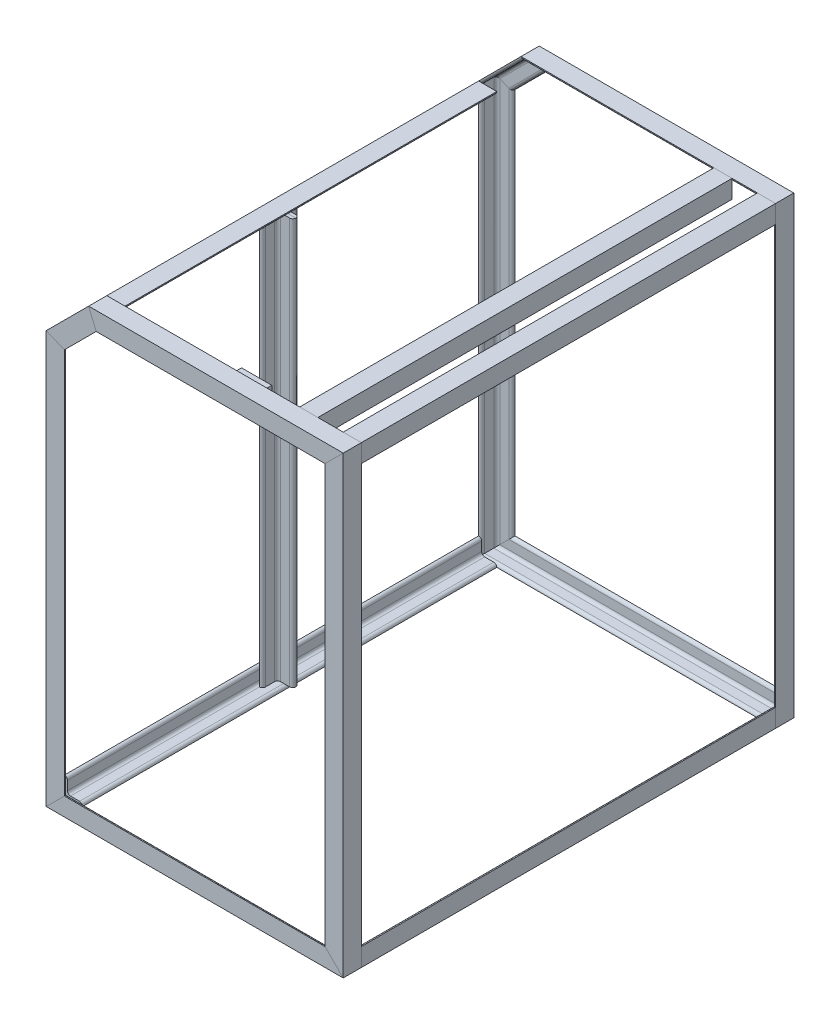
from build123d import *

# Parameters (mm, degrees)
ANGLE_IRON_CONFIGURED_35_X_35_X_5_1_DEPTH      = 793.426406871
ANGLE_IRON_CONFIGURED_35_X_35_X_5_1_DEPTH_BACK = 43.426406871
ANGLE_IRON_CONFIGURED_35_X_35_X_5_1_2_DEPTH    = 576.852813742
ANGLE_IRON_CONFIGURED_35_X_35_X_5_1_3_DEPTH    = 742
ANGLE_IRON_CONFIGURED_35_X_35_X_5_1_4_DEPTH    = 136.142135624
ANGLE_IRON_CONFIGURED_35_X_35_X_5_1_5_DEPTH    = 482
ANGLE_START                                    = -713.4
ANGLE_IRON_CONFIGURED_35_X_35_X_5_11_DEPTH     = 683.4
ANGLE_IRON_CONFIGURED_35_X_35_X_5_13_DEPTH     = 670
ANGLE_IRON_CONFIGURED_35_X_35_X_5_14_DEPTH     = 670
ANGLE_IRON_CONFIGURED_35_X_35_X_5_15_DEPTH     = 50
SKETCH19_R                                     = 4.5
CUT_EXTRUDE1_DEPTH                             = 10
ANGLE_IRON_CONFIGURED_35_X_35_X_5_16_DEPTH     = 683.4


# Read off the part's stored shape, not the designer's step: Angle iron - configured 35 X 35 X 5(2)
with BuildPart() as part:
    # Sketch11 → Angle iron - configured 35 X 35 X 5(1) (new, two sides: drawn at the far end of the back side and taken through both)
    with BuildSketch(Plane(origin=(245, 375, 0), x_dir=(-1, 0, 0), z_dir=(0, -1, 0)).offset(-ANGLE_IRON_CONFIGURED_35_X_35_X_5_1_DEPTH_BACK)):
        with BuildLine():
            Line((0, 0), (0, 30))
            ThreePointArc((0, 30), (3.535533906, 28.535533906), (5, 25))
            Line((5, 25), (5, 10))
            ThreePointArc((5, 10), (6.464466094, 6.464466094), (10, 5))
            Line((10, 5), (25, 5))
            ThreePointArc((25, 5), (28.535533906, 3.535533906), (30, 0))
            Line((30, 0), (0, 0))
        make_face()
    extrude(amount=ANGLE_IRON_CONFIGURED_35_X_35_X_5_1_DEPTH + ANGLE_IRON_CONFIGURED_35_X_35_X_5_1_DEPTH_BACK)

    # Angle iron - configured 35 X 35 X 5(1) mi
    split(bisect_by=Plane(origin=(245, -375, 0), x_dir=(-0.707106781, 0.707106781, 0), z_dir=(0.707106781, 0.707106781, 0)), keep=Keep.TOP)

    # Angle iron - configured 35 X 35 X 5_ 2
    split(bisect_by=Plane(origin=(245, 375, 0), x_dir=(0.707106781, 0.707106781, 0), z_dir=(0.707106781, -0.707106781, 0)), keep=Keep.TOP)


with BuildPart() as body_2:
    # Sketch11 on segment 2 (carried to segment 2) → Angle iron - configured 35 X 35 X 5_1 2 (new body)
    with BuildSketch(Plane(origin=(288.426406871, -375, 0), x_dir=(0, 1, 0), z_dir=(-1, 0, 0))):
        with BuildLine():
            Line((0, 0), (0, 30))
            ThreePointArc((0, 30), (3.535533906, 28.535533906), (5, 25))
            Line((5, 25), (5, 10))
            ThreePointArc((5, 10), (6.464466094, 6.464466094), (10, 5))
            Line((10, 5), (25, 5))
            ThreePointArc((25, 5), (28.535533906, 3.535533906), (30, 0))
            Line((30, 0), (0, 0))
        make_face()
    extrude(amount=ANGLE_IRON_CONFIGURED_35_X_35_X_5_1_2_DEPTH)

    # Angle iron - configured 35 X 35 X 5_ 3
    split(bisect_by=Plane(origin=(-245, -375, 0), x_dir=(0.707106781, 0.707106781, 0), z_dir=(0.707106781, -0.707106781, 0)), keep=Keep.TOP)

    # Angle iron - configured 35 X 35 X 5_ 4
    split(bisect_by=Plane(origin=(245, -375, 0), x_dir=(0.707106781, -0.707106781, 0), z_dir=(-0.707106781, -0.707106781, 0)), keep=Keep.TOP)


with BuildPart() as body_3:
    # Sketch11 on segment 3 (carried to segment 3) → Angle iron - configured 35 X 35 X 5_1 3 (new body)
    with BuildSketch(Plane(origin=(-245, -418.426406871, 0), x_dir=(1, 0, 0), z_dir=(0, 1, 0))):
        with BuildLine():
            Line((0, 0), (0, 30))
            ThreePointArc((0, 30), (3.535533906, 28.535533906), (5, 25))
            Line((5, 25), (5, 10))
            ThreePointArc((5, 10), (6.464466094, 6.464466094), (10, 5))
            Line((10, 5), (25, 5))
            ThreePointArc((25, 5), (28.535533906, 3.535533906), (30, 0))
            Line((30, 0), (0, 0))
        make_face()
    extrude(amount=ANGLE_IRON_CONFIGURED_35_X_35_X_5_1_3_DEPTH)

    # Angle iron - configured 35 X 35 X 5_ 5
    split(bisect_by=Plane(origin=(-245, -375, 0), x_dir=(-0.707106781, -0.707106781, 0), z_dir=(-0.707106781, 0.707106781, 0)), keep=Keep.TOP)

    # Angle iron - configured 35 X 35 X 5_ 6
    split(bisect_by=Plane(origin=(-245, 305, 0), x_dir=(0.923879533, -0.382683432, 0), z_dir=(-0.382683432, -0.923879533, 0)), keep=Keep.TOP)


with BuildPart() as body_4:
    # Sketch11 on segment 4 (carried to segment 4) → Angle iron - configured 35 X 35 X 5_1 4 (new body)
    with BuildSketch(Plane(origin=(-258.133513652, 291.866486348, 0), x_dir=(0.707106781, -0.707106781, 0), z_dir=(0.707106781, 0.707106781, 0))):
        with BuildLine():
            Line((0, 0), (0, 30))
            ThreePointArc((0, 30), (3.535533906, 28.535533906), (5, 25))
            Line((5, 25), (5, 10))
            ThreePointArc((5, 10), (6.464466094, 6.464466094), (10, 5))
            Line((10, 5), (25, 5))
            ThreePointArc((25, 5), (28.535533906, 3.535533906), (30, 0))
            Line((30, 0), (0, 0))
        make_face()
    extrude(amount=ANGLE_IRON_CONFIGURED_35_X_35_X_5_1_4_DEPTH)

    # Angle iron - configured 35 X 35 X 5_ 7
    split(bisect_by=Plane(origin=(-245, 305, 0), x_dir=(-0.923879533, 0.382683432, 0), z_dir=(0.382683432, 0.923879533, 0)), keep=Keep.TOP)

    # Angle iron - configured 35 X 35 X 5_ 8
    split(bisect_by=Plane(origin=(-175, 375, 0), x_dir=(0.382683432, -0.923879533, 0), z_dir=(-0.923879533, -0.382683432, 0)), keep=Keep.TOP)


with BuildPart() as body_5:
    # Sketch11 on segment 5 (carried to segment 5) → Angle iron - configured 35 X 35 X 5_1 5 (new body)
    with BuildSketch(Plane(origin=(-193.573593129, 375, 0), x_dir=(0, -1, 0), z_dir=(1, 0, 0))):
        with BuildLine():
            Line((0, 0), (0, 30))
            ThreePointArc((0, 30), (3.535533906, 28.535533906), (5, 25))
            Line((5, 25), (5, 10))
            ThreePointArc((5, 10), (6.464466094, 6.464466094), (10, 5))
            Line((10, 5), (25, 5))
            ThreePointArc((25, 5), (28.535533906, 3.535533906), (30, 0))
            Line((30, 0), (0, 0))
        make_face()
    extrude(amount=ANGLE_IRON_CONFIGURED_35_X_35_X_5_1_5_DEPTH)

    # Angle iron - configured 35 X 35 X 5_ 9
    split(bisect_by=Plane(origin=(-175, 375, 0), x_dir=(-0.382683432, 0.923879533, 0), z_dir=(0.923879533, 0.382683432, 0)), keep=Keep.TOP)

    # Angle iron - configured 35 X 35 X 5_ 10
    split(bisect_by=Plane(origin=(245, 375, 0), x_dir=(-0.707106781, -0.707106781, 0), z_dir=(-0.707106781, 0.707106781, 0)), keep=Keep.TOP)


with BuildPart() as body_6:
    # Mirror1: mirrored copy
    add(body_4.part.mirror(Plane.XY.offset(-371.7)))


with BuildPart() as body_7:
    # Mirror1 2: mirrored copy
    add(part.part.mirror(Plane.XY.offset(-371.7)))


with BuildPart() as body_8:
    # Mirror1 3: mirrored copy
    add(body_2.part.mirror(Plane.XY.offset(-371.7)))


with BuildPart() as body_9:
    # Mirror1 4: mirrored copy
    add(body_3.part.mirror(Plane.XY.offset(-371.7)))


with BuildPart() as body_10:
    # Mirror1 5: mirrored copy
    add(body_5.part.mirror(Plane.XY.offset(-371.7)))


with BuildPart() as body_11:
    # Angle iron - configured 35 X 35 X 5_ 12 → Angle iron - configured 35 X 35 X 5_ 11 (new body)
    with BuildSketch(Plane.XY.offset(ANGLE_START)):
        with BuildLine():
            Line((-245, 305), (-245, 275))
            ThreePointArc((-245, 275), (-241.464466094, 276.464466094), (-240, 280))
            Line((-240, 280), (-240, 295))
            ThreePointArc((-240, 295), (-238.535533906, 298.535533906), (-235, 300))
            Line((-235, 300), (-220, 300))
            ThreePointArc((-220, 300), (-216.464466094, 301.464466094), (-215, 305))
            Line((-215, 305), (-245, 305))
        make_face()
        with BuildLine():
            Line((-245, -345), (-245, -375))
            Line((-245, -375), (-215, -375))
            ThreePointArc((-215, -375), (-216.464466094, -371.464466094), (-220, -370))
            Line((-220, -370), (-235, -370))
            ThreePointArc((-235, -370), (-238.535533906, -368.535533906), (-240, -365))
            Line((-240, -365), (-240, -350))
            ThreePointArc((-240, -350), (-241.464466094, -346.464466094), (-245, -345))
        make_face()
        with BuildLine():
            Line((235, -370), (220, -370))
            ThreePointArc((220, -370), (216.464466094, -371.464466094), (215, -375))
            Line((215, -375), (245, -375))
            Line((245, -375), (245, -345))
            ThreePointArc((245, -345), (241.464466094, -346.464466094), (240, -350))
            Line((240, -350), (240, -365))
            ThreePointArc((240, -365), (238.535533906, -368.535533906), (235, -370))
        make_face()
        with BuildLine():
            Line((245, 345), (245, 375))
            Line((245, 375), (215, 375))
            ThreePointArc((215, 375), (216.464466094, 371.464466094), (220, 370))
            Line((220, 370), (235, 370))
            ThreePointArc((235, 370), (238.535533906, 368.535533906), (240, 365))
            Line((240, 365), (240, 350))
            ThreePointArc((240, 350), (241.464466094, 346.464466094), (245, 345))
        make_face()
    extrude(amount=ANGLE_IRON_CONFIGURED_35_X_35_X_5_11_DEPTH)


with BuildPart() as body_12:
    # Sketch16 → Angle iron - configured 35 X 35 X 5(13) (new body)
    with BuildSketch(Plane(origin=(-235, -370, -371.7), x_dir=(1, 0, 0), z_dir=(0, 1, 0))):
        with BuildLine():
            Line((0, 0), (0, 30))
            ThreePointArc((0, 30), (3.535533906, 28.535533906), (5, 25))
            Line((5, 25), (5, 10))
            ThreePointArc((5, 10), (6.464466094, 6.464466094), (10, 5))
            Line((10, 5), (25, 5))
            ThreePointArc((25, 5), (28.535533906, 3.535533906), (30, 0))
            Line((30, 0), (0, 0))
        make_face()
    extrude(amount=ANGLE_IRON_CONFIGURED_35_X_35_X_5_13_DEPTH)


with BuildPart() as body_13:
    # Sketch17 → Angle iron - configured 35 X 35 X 5(14) (new body)
    with BuildSketch(Plane(origin=(-235, -370, -371.7), x_dir=(1, 0, 0), z_dir=(0, -1, 0))):
        with BuildLine():
            Line((0, 0), (0, 30))
            ThreePointArc((0, 30), (3.535533906, 28.535533906), (5, 25))
            Line((5, 25), (5, 10))
            ThreePointArc((5, 10), (6.464466094, 6.464466094), (10, 5))
            Line((10, 5), (25, 5))
            ThreePointArc((25, 5), (28.535533906, 3.535533906), (30, 0))
            Line((30, 0), (0, 0))
        make_face()
    extrude(amount=-ANGLE_IRON_CONFIGURED_35_X_35_X_5_14_DEPTH)


with BuildPart() as body_14:
    # Sketch18 → Angle iron - configured 35 X 35 X 5(15) (new body)
    with BuildSketch(Plane(origin=(34.278699133, 370, -43), x_dir=(0, -1, 0), z_dir=(-1, 0, 0))):
        with BuildLine():
            Line((0, 0), (0, 35))
            ThreePointArc((0, 35), (3.535533906, 33.535533906), (5, 30))
            Line((5, 30), (5, 10))
            ThreePointArc((5, 10), (6.464466094, 6.464466094), (10, 5))
            Line((10, 5), (30, 5))
            ThreePointArc((30, 5), (33.535533906, 3.535533906), (35, 0))
            Line((35, 0), (0, 0))
        make_face()
    extrude(amount=-ANGLE_IRON_CONFIGURED_35_X_35_X_5_15_DEPTH)

    # Sketch19 → Cut-Extrude1 (cut)
    with BuildSketch(Plane(origin=(0, 0, -43), x_dir=(-1, 0, 0), z_dir=(0, 0, -1))):
        with Locations(Location((-59.278699133, 348, 0), (0, 0, 90))):
            Circle(SKETCH19_R)
    extrude(amount=-CUT_EXTRUDE1_DEPTH, mode=Mode.SUBTRACT)


with BuildPart() as body_15:
    # Sketch110 → Angle iron - configured 35 X 35 X 5(16) (new body)
    with BuildSketch(Plane(origin=(173.180028523, 375, -713.4), x_dir=(0, -1, 0), z_dir=(0, 0, -1))):
        with BuildLine():
            Line((0, 0), (0, 30))
            ThreePointArc((0, 30), (3.535533906, 28.535533906), (5, 25))
            Line((5, 25), (5, 10))
            ThreePointArc((5, 10), (6.464466094, 6.464466094), (10, 5))
            Line((10, 5), (25, 5))
            ThreePointArc((25, 5), (28.535533906, 3.535533906), (30, 0))
            Line((30, 0), (0, 0))
        make_face()
    extrude(amount=-ANGLE_IRON_CONFIGURED_35_X_35_X_5_16_DEPTH)


solid = Compound([part.part, body_2.part, body_3.part, body_4.part, body_5.part, body_6.part, body_7.part, body_8.part, body_9.part, body_10.part, body_11.part, body_12.part, body_13.part, body_14.part, body_15.part])
